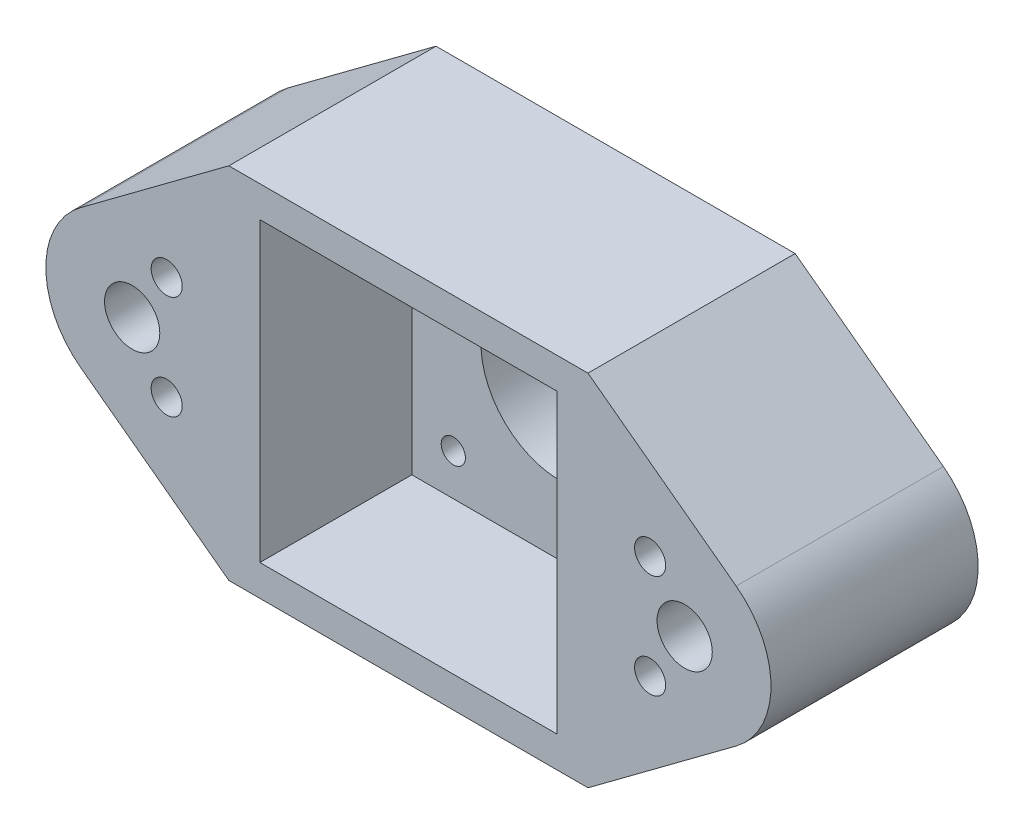
from build123d import *

# Parameters (mm, degrees)
ESBO_O1_R                = 1.75
ESBO_O1_R_2              = 11.5
ESBO_O1_R_3              = 4
ESBO_O1_R_4              = 2.25
RESSALTO_EXTRUS_O1_DEPTH = 30
ESBO_O2_W                = 43
ESBO_O2_H                = 43
CORTE_EXTRUS_O1_DEPTH    = 22


with BuildPart() as part:
    # Esboço1 → Ressalto-extrusão1 (new body)
    with BuildSketch(Plane.XY):
        with BuildLine():
            Line((-26, 26), (26, 26))
            Line((26, 26), (47.462602, 10.027939539))
            ThreePointArc((47.462602, 10.027939539), (52.5, 0), (47.462602, -10.027939539))
            Line((47.462602, -10.027939539), (26, -26))
            Line((26, -26), (-26, -26))
            Line((-26, -26), (-47.462602, -10.027939539))
            ThreePointArc((-47.462602, -10.027939539), (-52.5, 0), (-47.462602, 10.027939539))
            Line((-47.462602, 10.027939539), (-26, 26))
        make_face()
        with Locations((-15.5, 15.5)):
            Circle(ESBO_O1_R, mode=Mode.SUBTRACT)
        with Locations((15.5, 15.5)):
            Circle(ESBO_O1_R, mode=Mode.SUBTRACT)
        with Locations((15.5, -15.5)):
            Circle(ESBO_O1_R, mode=Mode.SUBTRACT)
        with Locations((-15.5, -15.5)):
            Circle(ESBO_O1_R, mode=Mode.SUBTRACT)
        Circle(ESBO_O1_R_2, mode=Mode.SUBTRACT)
        with Locations((-40, 0)):
            Circle(ESBO_O1_R_3, mode=Mode.SUBTRACT)
        with Locations((40, 0)):
            Circle(ESBO_O1_R_3, mode=Mode.SUBTRACT)
        with Locations((-35, 7.5)):
            Circle(ESBO_O1_R_4, mode=Mode.SUBTRACT)
        with Locations((-35, -7.5)):
            Circle(ESBO_O1_R_4, mode=Mode.SUBTRACT)
        with Locations((35, -7.5)):
            Circle(ESBO_O1_R_4, mode=Mode.SUBTRACT)
        with Locations((35, 7.5)):
            Circle(ESBO_O1_R_4, mode=Mode.SUBTRACT)
    extrude(amount=RESSALTO_EXTRUS_O1_DEPTH)

    # Esboço2 → Corte-extrusão1 (cut)
    with BuildSketch(Plane.XY.offset(30)):
        Rectangle(ESBO_O2_W, ESBO_O2_H)
    extrude(amount=-CORTE_EXTRUS_O1_DEPTH, mode=Mode.SUBTRACT)


solid = part.part
